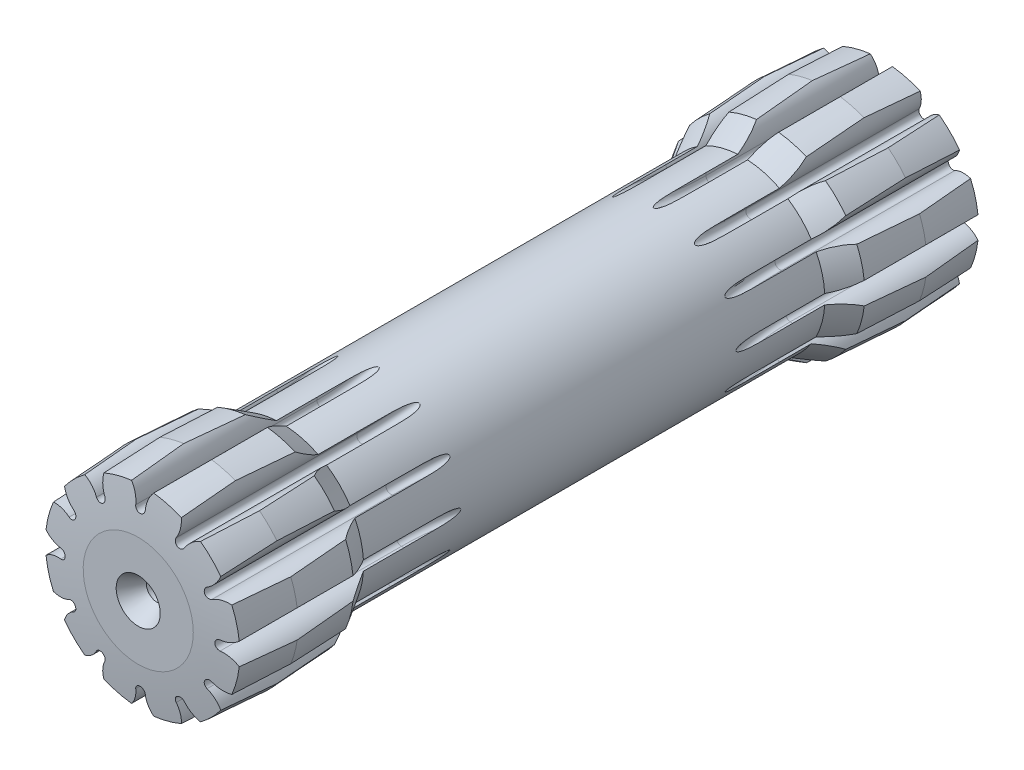
from build123d import *

# Parameters (mm, degrees)
CUT_EXTRUDE1_DEPTH = 25
CIRPATTERN1_COUNT  = 12
CUT_EXTRUDE2_START = -25
CUT_EXTRUDE2_DEPTH = 25
CIRPATTERN2_COUNT  = 12


with BuildPart() as part:
    # Sketch1 → Revolve1 (revolve)
    with BuildSketch(Plane(origin=(0, 0, 0), x_dir=(0, 0, -1), z_dir=(1, 0, 0))):
        with BuildLine():
            Line((0.600052846, 13.25), (8.1, 13.69))
            Line((8.1, 13.69), (16.1, 13.25))
            Line((16.1, 13.25), (19.5, 11.2))
            Line((19.5, 11.2), (82.35, 11.2))
            Line((82.35, 11.2), (85.75, 13.25))
            Line((85.75, 13.25), (93.75, 13.69))
            Line((93.75, 13.69), (101.249947154, 13.25))
            ThreePointArc((101.249947154, 13.25), (101.591534816, 10.379337207), (101.85, 7.5))
            Line((101.85, 7.5), (101.85, 0))
            Line((101.85, 0), (0, 0))
            Line((0, 0), (0, 7.5))
            ThreePointArc((0, 7.5), (0.258465184, 10.379337207), (0.600052846, 13.25))
        make_face()
    revolve(axis=Axis((0, 0, 0), (0, 0, -1)))

    # Sketch2 → Cut-Revolve1 (revolve, cut)
    with BuildSketch(Plane(origin=(0, 0, 0), x_dir=(0, 0, -1), z_dir=(1, 0, 0))):
        Polygon((101.85, 3), (99.251923789, 1.5), (96.751290929, 1.5), (95.85, 0), (101.85, 0), align=None)
    revolve(axis=Axis((0, 0, 0), (0, 0, -1)), mode=Mode.SUBTRACT)

    # Sketch3 → Cut-Revolve2 (revolve, cut)
    with BuildSketch(Plane(origin=(0, 0, 0), x_dir=(0, 0, -1), z_dir=(1, 0, 0))):
        Polygon((0, 3), (2.598076211, 1.5), (5.098709071, 1.5), (6, 0), (0, 0), align=None)
    revolve(axis=Axis((0, 0, 0), (0, 0, -1)), mode=Mode.SUBTRACT)

    # Sketch4 → Cut-Extrude1 (cut)
    with BuildSketch(Plane.XY.offset(-103)):
        with BuildLine():
            ThreePointArc((-0.65, 10.85), (0, 10.2), (0.65, 10.85))
            ThreePointArc((0.65, 10.85), (0.977583424, 12.341066306), (1.9, 13.557510833))
            ThreePointArc((1.9, 13.557510833), (0, 13.69), (-1.9, 13.557510833))
            ThreePointArc((-1.9, 13.557510833), (-0.977583424, 12.341066306), (-0.65, 10.85))
        make_face()
    cut_extrude1 = extrude(amount=CUT_EXTRUDE1_DEPTH, mode=Mode.SUBTRACT)

    # Sketch6 → Cut-Revolve3 (revolve, cut)
    with BuildSketch(Plane(origin=(0, 0, -78), x_dir=(-1, 0, 0), z_dir=(0, 0, -1))):
        with BuildLine():
            Line((-1.505655126, 13.16417497), (-1.505655126, 15.404021176))
            Line((-1.505655126, 15.404021176), (1.505655126, 15.404021176))
            Line((1.505655126, 15.404021176), (1.505655126, 13.16417497))
            ThreePointArc((1.505655126, 13.16417497), (0.870764138, 12.083648196), (0.65, 10.85))
            ThreePointArc((0.65, 10.85), (0, 10.2), (-0.65, 10.85))
            ThreePointArc((-0.65, 10.85), (-0.870764138, 12.083648196), (-1.505655126, 13.16417497))
        make_face()
    cut_revolve3 = revolve(axis=Axis((8.494917218, 40.85, -78), (-1, 0, 0)), mode=Mode.SUBTRACT)

    # CirPattern1: Cut-Extrude1, Cut-Revolve3 ×12 about axis
    cirpattern1_axis = Axis((0, 0, -82.35), (0, 0, 1))
    add([cut_extrude1.rotate(cirpattern1_axis, i * 360 / CIRPATTERN1_COUNT) for i in range(1, CIRPATTERN1_COUNT)], mode=Mode.SUBTRACT)
    add([cut_revolve3.rotate(cirpattern1_axis, i * 360 / CIRPATTERN1_COUNT) for i in range(1, CIRPATTERN1_COUNT)], mode=Mode.SUBTRACT)

    # Sketch5 → Cut-Extrude2 (cut)
    with BuildSketch(Plane.XY.offset(CUT_EXTRUDE2_START)):
        with BuildLine():
            Line((-3, 14.196125526), (-3, 15.196098841))
            Line((-3, 15.196098841), (3, 15.196098841))
            Line((3, 15.196098841), (3, 14.196125526))
            ThreePointArc((3, 14.196125526), (1.296192058, 12.894447116), (0.65, 10.85))
            ThreePointArc((0.65, 10.85), (0, 10.2), (-0.65, 10.85))
            ThreePointArc((-0.65, 10.85), (-1.296192058, 12.894447116), (-3, 14.196125526))
        make_face()
    cut_extrude2 = extrude(amount=CUT_EXTRUDE2_DEPTH, mode=Mode.SUBTRACT)

    # Sketch8 → Cut-Revolve5 (revolve, cut)
    with BuildSketch(Plane.XY.offset(-25)):
        with BuildLine():
            Line((1.505655126, 13.16417497), (1.505655126, 15.404021176))
            Line((1.505655126, 15.404021176), (-1.505655126, 15.404021176))
            Line((-1.505655126, 15.404021176), (-1.505655126, 13.16417497))
            ThreePointArc((-1.505655126, 13.16417497), (-0.870764138, 12.083648196), (-0.65, 10.85))
            ThreePointArc((-0.65, 10.85), (0, 10.2), (0.65, 10.85))
            ThreePointArc((0.65, 10.85), (0.870764138, 12.083648196), (1.505655126, 13.16417497))
        make_face()
    cut_revolve5 = revolve(axis=Axis((-13.647220523, 40.85, -25), (1, 0, 0)), mode=Mode.SUBTRACT)

    # CirPattern2: Cut-Extrude2, Cut-Revolve5 ×12 about axis
    cirpattern2_axis = Axis((0, 0, -82.35), (0, 0, 1))
    add([cut_extrude2.rotate(cirpattern2_axis, i * 360 / CIRPATTERN2_COUNT) for i in range(1, CIRPATTERN2_COUNT)], mode=Mode.SUBTRACT)
    add([cut_revolve5.rotate(cirpattern2_axis, i * 360 / CIRPATTERN2_COUNT) for i in range(1, CIRPATTERN2_COUNT)], mode=Mode.SUBTRACT)


solid = part.part
